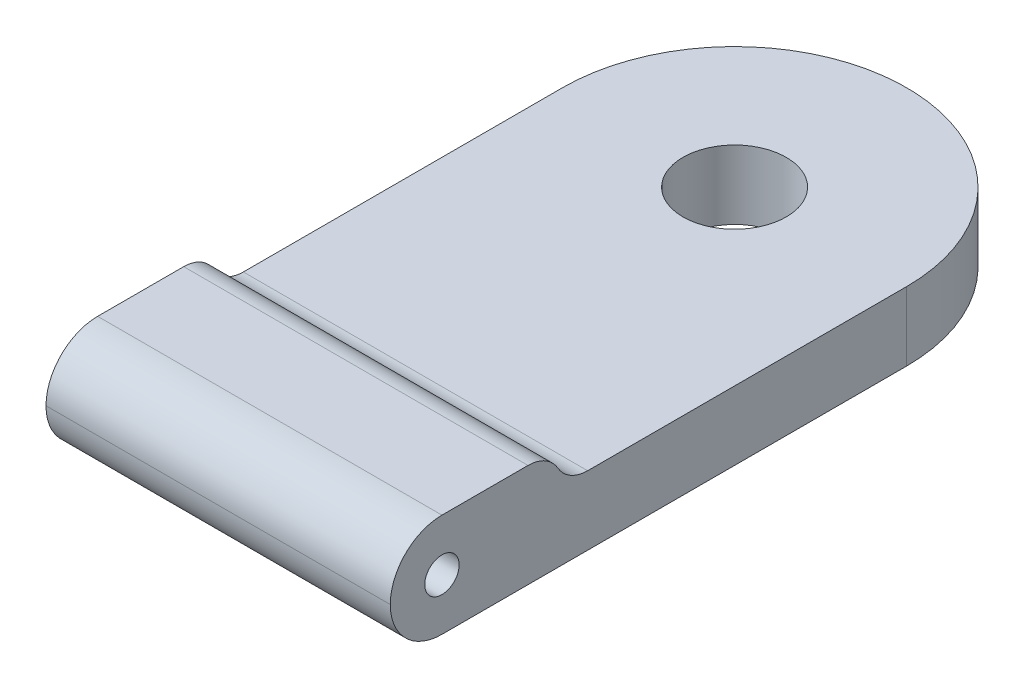
from build123d import *

# Parameters (mm, degrees)
SALIENTE_EXTRUIR1_DEPTH = 3
CROQUIS3_W              = 15
CROQUIS3_H              = 1
CORTAR_EXTRUIR1_DEPTH   = 10
REDONDEO1_R             = 1
REDONDEO3_R             = 1
CROQUIS4_R              = 0.5
CORTAR_EXTRUIR2_DEPTH   = 10
REDONDEO4_R             = 1.5
REDONDEO5_R             = 1.5
CROQUIS5_R              = 1.5
CORTAR_EXTRUIR3_DEPTH   = 3


with BuildPart() as part:
    # Croquis1 → Saliente-Extruir1 (new body)
    with BuildSketch(Plane(origin=(0, 0, 0), x_dir=(1, 0, 0), z_dir=(0, 1, 0))):
        with BuildLine():
            Line((0, 0), (10, 0))
            Line((10, 0), (10, 15))
            ThreePointArc((10, 15), (5, 20), (0, 15))
            Line((0, 15), (0, 0))
        make_face()
    extrude(amount=SALIENTE_EXTRUIR1_DEPTH)

    # Croquis3 → Cortar-Extruir1 (cut)
    with BuildSketch(Plane(origin=(0, 0, 0), x_dir=(0, 0, -1), z_dir=(1, 0, 0))):
        with Locations((12.5, 2.5)):
            Rectangle(CROQUIS3_W, CROQUIS3_H)
    extrude(amount=CORTAR_EXTRUIR1_DEPTH, mode=Mode.SUBTRACT)

    # Redondeo1
    redondeo1_edges = [part.edges().sort_by_distance(p)[0] for p in [
        (5, 3, -5),
    ]]
    fillet(redondeo1_edges, radius=REDONDEO1_R - 0.0001)  # a hair under: the kernel refuses the full size

    # Redondeo3
    redondeo3_edges = [part.edges().sort_by_distance(p)[0] for p in [
        (5, 2, -5),
    ]]
    fillet(redondeo3_edges, radius=REDONDEO3_R)

    # Croquis4 → Cortar-Extruir2 (cut)
    with BuildSketch(Plane(origin=(10, 0, 0), x_dir=(0, 0, -1), z_dir=(1, 0, 0))):
        with Locations((1.5, 1.5)):
            Circle(CROQUIS4_R)
    extrude(amount=-CORTAR_EXTRUIR2_DEPTH, mode=Mode.SUBTRACT)

    # Redondeo4
    redondeo4_edges = [part.edges().sort_by_distance(p)[0] for p in [
        (5, 3, 0),
    ]]
    fillet(redondeo4_edges, radius=REDONDEO4_R)

    # Redondeo5
    redondeo5_edges = [part.edges().sort_by_distance(p)[0] for p in [
        (5, 0, 0),
    ]]
    fillet(redondeo5_edges, radius=REDONDEO5_R - 0.0001)  # a hair under: the kernel refuses the full size

    # Croquis5 → Cortar-Extruir3 (cut)
    with BuildSketch(Plane(origin=(0, 2, 0), x_dir=(1, 0, 0), z_dir=(0, 1, 0))):
        with Locations(Location((5, 15, 0), (0, 0, 270))):
            Circle(CROQUIS5_R)
    extrude(amount=-CORTAR_EXTRUIR3_DEPTH, mode=Mode.SUBTRACT)


solid = part.part
